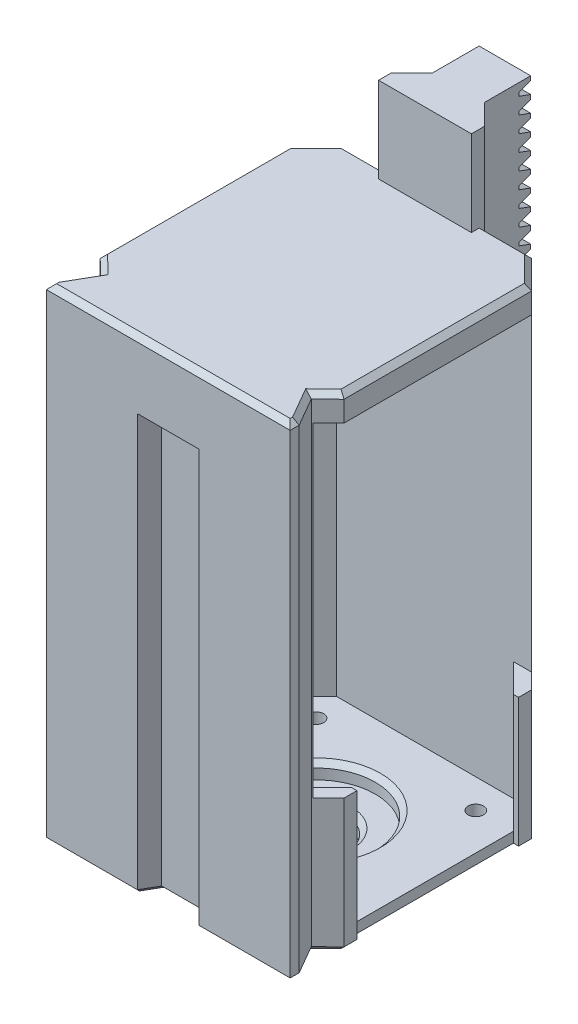
from build123d import *

# Parameters (mm, degrees)
SKETCH1_R                                     = 1.5
SKETCH1_R_2                                   = 11.5
MOUNT_FACE_EXTRUDE_DEPTH                      = 3
BRACKET_MOUNT_HOLE_CHAMFER_SIZE               = 0.75
MAIN_BODY_EXTRUDE_DEPTH                       = 94
FRONT_FACE_FILL_IN_EXTRUDE_DEPTH              = 3
MOTOR_START                                   = -6.65
SKETCH31_W                                    = 42.3
SKETCH31_H                                    = 63
MOTOR_INSERT_CUT_DEPTH                        = 6.65
MAIN_BODY_BACK_WALL_EXTRUDE_DEPTH             = 5
LIMIT_TAB_DEPTH                               = 81
RACK_EXTRUDE_DEPTH                            = 5
RACK_CHAMFER_SIZE                             = 4
RACK_SUPPORT_BASE_EXTRUDE_DEPTH               = 16.59699335
FACE_START                                    = 4
SKETCH27_R                                    = 13.6
SKETCH27_R_2                                  = 11.5
SKETCH27_R_3                                  = 6
FACE_COSMETIC_RING_EXTRUDE_DEPTH              = 4
FACE_COSMETIC_RING_MAIN_CHAMFER_SIZE          = 4
FACE_COSMETIC_RING_MAIN_THROUGH_HOLE_CHA_SIZE = 1
FRONT_BACK_FACE_CHAMFER_SIZE                  = 1


with BuildPart() as part:
    # Sketch1 → Mount Face Extrude (new body)
    with BuildSketch(Plane(origin=(0, 0, 0), x_dir=(1, 0, 0), z_dir=(0, 1, 0))):
        Polygon((-21.15, 17.15), (-17.15, 21.15), (17.15, 21.15), (21.15, 17.15), (21.15, -17.15), (17, -21.15), (-17, -21.15), (-21.15, -17.15), align=None)
        with Locations(Location((-15.5, 15.5, 0), (0, 0, 270))):
            Circle(SKETCH1_R, mode=Mode.SUBTRACT)
        with Locations(Location((15.5, 15.5, 0), (0, 0, 270))):
            Circle(SKETCH1_R, mode=Mode.SUBTRACT)
        with Locations(Location((15.5, -15.5, 0), (0, 0, 270))):
            Circle(SKETCH1_R, mode=Mode.SUBTRACT)
        with Locations(Location((-15.5, -15.5, 0), (0, 0, 270))):
            Circle(SKETCH1_R, mode=Mode.SUBTRACT)
        with Locations(Location((0, 0, 0), (0, 0, 270))):
            Circle(SKETCH1_R_2, mode=Mode.SUBTRACT)
    extrude(amount=MOUNT_FACE_EXTRUDE_DEPTH)

    # Bracket Mount Hole Chamfer
    bracket_mount_hole_chamfer_edges = [part.edges().sort_by_distance(p)[0] for p in [
        (-15.5, 0, -17),
        (15.5, 0, -17),
        (15.5, 0, 14),
        (-15.5, 0, 14),
    ]]
    chamfer(bracket_mount_hole_chamfer_edges, length=BRACKET_MOUNT_HOLE_CHAMFER_SIZE)

    # Sketch5 → Main Body Extrude (add)
    with BuildSketch(Plane(origin=(0, 0, 0), x_dir=(1, 0, 0), z_dir=(0, 1, 0))):
        Polygon((21.15, -17.15), (22.65, -15.704216867), (23.65, -15.704216867), (23.65, -18.212588103), (20.420896185, -21.324977322), (23.65, -26.917949192), (23.65, -28.65), (-23.65, -28.65), (-23.65, -26.917949192), (-20.420896185, -21.324977322), (-23.65, -18.212588103), (-23.65, 14.65), (-23.65, 18.185533906), (-18.185533906, 23.65), (18.185533906, 23.65), (23.65, 18.185533906), (23.65, 15.65), (22.65, 15.65), (21.15, 17.15), (17.15, 21.15), (-17.15, 21.15), (-21.15, 17.15), (-21.15, -17.15), (-17, -21.15), (17, -21.15), align=None)
    extrude(amount=MAIN_BODY_EXTRUDE_DEPTH)

    # Sketch37 → Front Face Fill in Extrude (add)
    with BuildSketch(Plane.XZ):
        Polygon((21.15, -17.15), (22.65, -15.65), (22.65, 15.704216867), (21.15, 17.15), align=None)
    extrude(amount=-FRONT_FACE_FILL_IN_EXTRUDE_DEPTH)

    # Sketch31 → Motor Insert Cut (cut)
    with BuildSketch(Plane(origin=(23.65, 0, 0), x_dir=(0, 0, -1), z_dir=(1, 0, 0)).offset(MOTOR_START)):
        with Locations((0, 57.5)):
            Rectangle(SKETCH31_W, SKETCH31_H)
    extrude(amount=MOTOR_INSERT_CUT_DEPTH, mode=Mode.SUBTRACT)

    # Sketch33 → Main Body Back Wall Extrude (add)
    with BuildSketch(Plane(origin=(0, 94, 0), x_dir=(1, 0, 0), z_dir=(0, 1, 0))):
        Polygon((23.65, -15.704216867), (23.65, 15.65), (22.65, 15.65), (17.15, 21.15), (-17.15, 21.15), (-21.15, 17.15), (-21.15, -17.15), (-17, -21.15), (17, -21.15), (22.65, -15.704216867), align=None)
        Polygon((22.65, 15.65), (23.65, 15.65), (23.65, 18.185533906), (18.185533906, 23.65), (-18.185533906, 23.65), (-23.65, 18.185533906), (-23.65, -18.212588103), (-20.420896185, -21.324977322), (-23.65, -26.917949192), (-23.65, -28.65), (23.65, -28.65), (23.65, -26.917949192), (20.420896185, -21.324977322), (23.65, -18.212588103), (23.65, -15.704216867), (22.65, -15.704216867), (17, -21.15), (-17, -21.15), (-21.15, -17.15), (-21.15, 17.15), (-17.15, 21.15), (17.15, 21.15), align=None)
    extrude(amount=-MAIN_BODY_BACK_WALL_EXTRUDE_DEPTH)

    # Sketch39 → Limit Tab (cut)
    with BuildSketch(Plane.XZ):
        Polygon((-6, 28.65), (-4.267949192, 25.65), (4.267949192, 25.65), (6, 28.65), align=None)
    extrude(amount=-LIMIT_TAB_DEPTH, mode=Mode.SUBTRACT)

    # Sketch13 → Rack Extrude (add, symmetric)
    with BuildSketch(Plane(origin=(0, 0, 0), x_dir=(0, 0, -1), z_dir=(1, 0, 0))):
        Polygon((36.65, 6.9244359), (36.65, 6.08158005), (34.400000137, 5.262647), (34.400000137, 4.6017763), (36.65, 3.78284325), (36.65, 2.9399874), (34.400000137, 2.12105435), (34.400000137, 1.46018365), (36.65, 0.6412506), (36.65, 0), (23.65, 0), (23.65, 110.59699335), (36.65, 110.59699335), (36.65, 109.7541375), (34.400000137, 108.93520445), (34.400000137, 108.27433375), (36.65, 107.4554007), (36.65, 106.61254485), (34.400000137, 105.7936118), (34.400000137, 105.1327411), (36.65, 104.31380805), (36.65, 103.4709522), (34.400000137, 102.65201915), (34.400000137, 101.99114845), (36.65, 101.1722154), (36.65, 100.32935955), (34.400000137, 99.5104265), (34.400000137, 98.8495558), (36.65, 98.03062275), (36.65, 97.1877669), (34.400000137, 96.36883385), (34.400000137, 95.70796315), (36.65, 94.8890301), (36.65, 94.04617425), (34.400000137, 93.2272412), (34.400000137, 92.5663705), (36.65, 91.74743745), (36.65, 90.9045816), (34.400000137, 90.08564855), (34.400000137, 89.42477785), (36.65, 88.6058448), (36.65, 87.76298895), (34.400000137, 86.9440559), (34.400000137, 86.2831852), (36.65, 85.46425215), (36.65, 84.6213963), (34.400000137, 83.80246325), (34.400000137, 83.14159255), (36.65, 82.3226595), (36.65, 81.47980365), (34.400000137, 80.6608706), (34.400000137, 79.9999999), (36.65, 79.18106685), (36.65, 78.338211), (34.400000137, 77.51927795), (34.400000137, 76.85840725), (36.65, 76.0394742), (36.65, 75.19661835), (34.400000137, 74.3776853), (34.400000137, 73.7168146), (36.65, 72.89788155), (36.65, 72.0550257), (34.400000137, 71.23609265), (34.400000137, 70.57522195), (36.65, 69.7562889), (36.65, 68.91343305), (34.400000137, 68.0945), (34.400000137, 67.4336293), (36.65, 66.61469625), (36.65, 65.7718404), (34.400000137, 64.95290735), (34.400000137, 64.29203665), (36.65, 63.4731036), (36.65, 62.63024775), (34.400000137, 61.8113147), (34.400000137, 61.150444), (36.65, 60.33151095), (36.65, 59.4886551), (34.400000137, 58.66972205), (34.400000137, 58.00885135), (36.65, 57.1899183), (36.65, 56.34706245), (34.400000137, 55.5281294), (34.400000137, 54.8672587), (36.65, 54.04832565), (36.65, 53.2054698), (34.400000137, 52.38653675), (34.400000137, 51.72566605), (36.65, 50.906733), (36.65, 50.06387715), (34.400000137, 49.2449441), (34.400000137, 48.5840734), (36.65, 47.76514035), (36.65, 46.9222845), (34.400000137, 46.10335145), (34.400000137, 45.44248075), (36.65, 44.6235477), (36.65, 43.78069185), (34.400000137, 42.9617588), (34.400000137, 42.3008881), (36.65, 41.48195505), (36.65, 40.6390992), (34.400000137, 39.82016615), (34.400000137, 39.15929545), (36.65, 38.3403624), (36.65, 37.49750655), (34.400000137, 36.6785735), (34.400000137, 36.0177028), (36.65, 35.19876975), (36.65, 34.3559139), (34.400000137, 33.53698085), (34.400000137, 32.87611015), (36.65, 32.0571771), (36.65, 31.21432125), (34.400000137, 30.3953882), (34.400000137, 29.7345175), (36.65, 28.91558445), (36.65, 28.0727286), (34.400000137, 27.25379555), (34.400000137, 26.59292485), (36.65, 25.7739918), (36.65, 24.93113595), (34.400000137, 24.1122029), (34.400000137, 23.4513322), (36.65, 22.63239915), (36.65, 21.7895433), (34.400000137, 20.97061025), (34.400000137, 20.30973955), (36.65, 19.4908065), (36.65, 18.64795065), (34.400000137, 17.8290176), (34.400000137, 17.1681469), (36.65, 16.34921385), (36.65, 15.506358), (34.400000137, 14.68742495), (34.400000137, 14.02655425), (36.65, 13.2076212), (36.65, 12.36476535), (34.400000137, 11.5458323), (34.400000137, 10.8849616), (36.65, 10.06602855), (36.65, 9.2231727), (34.400000137, 8.40423965), (34.400000137, 7.74336895), align=None)
    extrude(amount=RACK_EXTRUDE_DEPTH, both=True)

    # Rack Chamfer
    rack_chamfer_edges = [part.edges().sort_by_distance(p)[0] for p in [
        (-5, 47, -23.65),
        (5, 47, -23.65),
    ]]
    chamfer(rack_chamfer_edges, length=RACK_CHAMFER_SIZE)

    # Sketch15 → Rack Support Base Extrude (add)
    with BuildSketch(Plane(origin=(0, 94, 0), x_dir=(1, 0, 0), z_dir=(0, 1, 0))):
        Polygon((-5, 27.65), (-9, 23.65), (-9, 21.15), (9, 21.15), (9, 23.65), (5, 27.65), align=None)
    extrude(amount=RACK_SUPPORT_BASE_EXTRUDE_DEPTH)

    # Sketch27 → Face Cosmetic Ring Extrude (add)
    # profile 1 of 2: a face of its own
    with BuildSketch(Plane(origin=(0, 0, 0), x_dir=(-1, 0, 0), z_dir=(0, -1, 0)).offset(FACE_START)):
        with Locations(Location((0, 0, 0), (0, 0, 90))):
            Circle(SKETCH27_R)
        with Locations(Location((0, 0, 0), (0, 0, 270))):
            Circle(SKETCH27_R_2, mode=Mode.SUBTRACT)
    # profile 2 of 2: a face of its own
    with BuildSketch(Plane(origin=(0, 0, 0), x_dir=(-1, 0, 0), z_dir=(0, -1, 0)).offset(FACE_START)):
        with Locations(Location((0, 0, 0), (0, 0, 270))):
            Circle(SKETCH27_R_2)
        with Locations(Location((0, 0, 0), (0, 0, 90))):
            Circle(SKETCH27_R_3, mode=Mode.SUBTRACT)
    extrude(amount=-FACE_COSMETIC_RING_EXTRUDE_DEPTH)

    # Face Cosmetic Ring Main Chamfer
    face_cosmetic_ring_main_chamfer_edges = [part.edges().sort_by_distance(p)[0] for p in [
        (0, 0, 13.6),
    ]]
    chamfer(face_cosmetic_ring_main_chamfer_edges, length=FACE_COSMETIC_RING_MAIN_CHAMFER_SIZE - 0.0001)  # a hair under: the kernel refuses the full size

    # Face Cosmetic Ring Main Through Hole Chamfer
    face_cosmetic_ring_main_through_hole_cha_edges = [part.edges().sort_by_distance(p)[0] for p in [
        (0, 3, -11.5),
        (0, 0, 6),
        (0, -4, 6),
    ]]
    chamfer(face_cosmetic_ring_main_through_hole_cha_edges, length=FACE_COSMETIC_RING_MAIN_THROUGH_HOLE_CHA_SIZE)

    # Front/Back Face Chamfer
    front_back_face_chamfer_edges = [part.edges().sort_by_distance(p)[0] for p in [
        (22.65, 0, 0.027108434),
        (20.917766953, 0, -20.917766953),
        (20.917766953, 94, -20.917766953),
        (23.15, 0, -15.65),
        (23.15, 0, 15.704216867),
        (-13.592766953, 0, -23.65),
        (-7, 0, -25.65),
        (-20.917766953, 0, -20.917766953),
        (-23.65, 0, 0.013527099),
        (-22.035448093, 0, 19.768782713),
        (-22.035448093, 0, 24.121463257),
        (7, 0, -25.65),
        (-23.65, 0, 27.783974596),
        (13.592766953, 0, -23.65),
        (-14.825, 0, 28.65),
        (-5.133974596, 0, 27.15),
        (23.65, 0, -16.917766953),
        (0, 0, 25.65),
        (5.133974596, 0, 27.15),
        (14.825, 0, 28.65),
        (23.65, 0, 27.783974596),
        (23.65, 0, 16.958402485),
        (22.035448093, 0, 24.121463257),
        (22.035448093, 0, 19.768782713),
        (22.035448093, 94, 19.768782713),
        (23.65, 94, 0.013527099),
        (13.592766953, 94, -23.65),
        (-20.917766953, 94, -20.917766953),
        (-23.65, 94, 0.013527099),
        (-22.035448093, 94, 19.768782713),
        (-22.035448093, 94, 24.121463257),
        (-23.65, 94, 27.783974596),
        (0, 94, 28.65),
        (23.65, 94, 27.783974596),
        (22.035448093, 94, 24.121463257),
        (-13.592766953, 94, -23.65),
    ]]
    chamfer(front_back_face_chamfer_edges, length=FRONT_BACK_FACE_CHAMFER_SIZE)


solid = part.part
